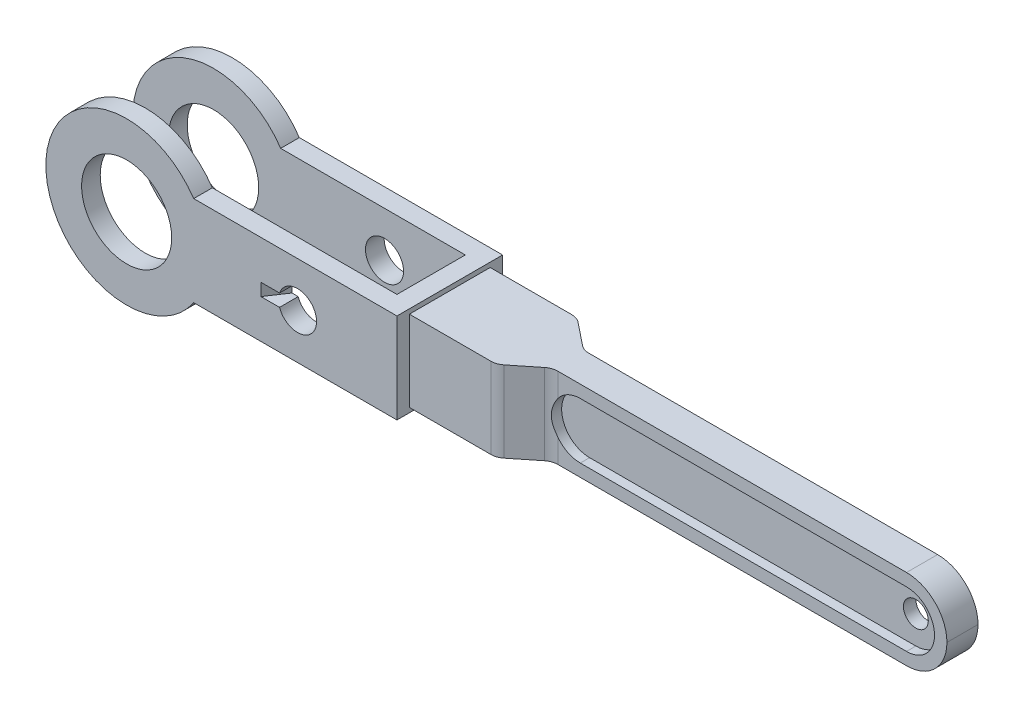
from build123d import *

# Parameters (mm, degrees)
ESBO_O1_R                  = 14.5
RESSALTO_EXTRUS_O1_DEPTH   = 34
CORTE_EXTRUS_O1_DEPTH      = 36
CORTE_EXTRUS_O1_DEPTH_BACK = 56
ESBO_O2_W                  = 115.279866195
ESBO_O2_H                  = 22
RESSALTO_EXTRUS_O2_DEPTH   = 4
RESSALTO_EXTRUS_O3_START   = -6
RESSALTO_EXTRUS_O3_DEPTH   = 6
ESBO_O5_W                  = 26
ESBO_O5_H                  = 26
RESSALTO_EXTRUS_O4_DEPTH   = 28
ESBO_O6_R                  = 9
CORTE_EXTRUS_O2_DEPTH      = 31
ESBO_O7_W                  = 10
ESBO_O7_H                  = 26
RESSALTO_EXTRUS_O5_DEPTH   = 10
RESSALTO_EXTRUS_O7_START   = -26
RESSALTO_EXTRUS_O7_DEPTH   = 26
FILETE1_R                  = 5
ESBO_O9_W                  = 10
ESBO_O9_H                  = 26
RESSALTO_EXTRUS_O8_DEPTH   = 127
FILETE2_R                  = 13
FILETE3_R                  = 5
CORTE_EXTRUS_O3_DEPTH      = 49
CORTE_EXTRUS_O3_DEPTH_BACK = 3
CORTE_EXTRUS_O4_DEPTH      = 52
CORTE_EXTRUS_O4_DEPTH_BACK = 3
CORTE_EXTRUS_O5_DEPTH      = 27
CORTE_EXTRUS_O5_DEPTH_BACK = 22
ESBO_O12_R                 = 4


with BuildPart() as part:
    # Esboço1 → Ressalto-extrusão1 (new body)
    with BuildSketch(Plane.XY):
        with BuildLine():
            Line((21.581241855, 14.5), (87, 14.5))
            Line((87, 14.5), (87, -14.5))
            Line((87, -14.5), (21.581241855, -14.5))
            ThreePointArc((21.581241855, -14.5), (-26, 0), (21.581241855, 14.5))
        make_face()
        Circle(ESBO_O1_R, mode=Mode.SUBTRACT)
        with BuildLine():
            ThreePointArc((49.210731912, -2), (61.125, 0), (49.210731912, 2))
            Line((49.210731912, 2), (43.210731912, 2))
            Line((43.210731912, 2), (43.210731912, -2))
            Line((43.210731912, -2), (49.210731912, -2))
        make_face(mode=Mode.SUBTRACT)
    extrude(amount=RESSALTO_EXTRUS_O1_DEPTH)

    # Esboço2 → Corte-extrusão1 (cut, two sides: drawn at the far end of the back side and taken through both)
    with BuildSketch(Plane(origin=(0, 14.5, 0), x_dir=(1, 0, 0), z_dir=(0, 1, 0)).offset(-CORTE_EXTRUS_O1_DEPTH_BACK)):
        with Locations((23.360066902, -17)):
            Rectangle(ESBO_O2_W, ESBO_O2_H)
    extrude(amount=CORTE_EXTRUS_O1_DEPTH + CORTE_EXTRUS_O1_DEPTH_BACK, mode=Mode.SUBTRACT)

    # Esboço3 → Ressalto-extrusão2 (add)
    with BuildSketch(Plane(origin=(0, -2, 0), x_dir=(1, 0, 0), z_dir=(0, 1, 0))):
        Polygon((43.210731912, -28), (47.210731912, -28), (43.210731912, -34), align=None)
    extrude(amount=RESSALTO_EXTRUS_O2_DEPTH)

    # Esboço4 → Ressalto-extrusão3 (add)
    with BuildSketch(Plane.XY.offset(6).offset(RESSALTO_EXTRUS_O3_START)):
        with BuildLine():
            ThreePointArc((49.210731912, 2), (48.875, 0), (49.210731912, -2))
            Line((49.210731912, -2), (43.210731912, -2))
            Line((43.210731912, -2), (43.210731912, 2))
            Line((43.210731912, 2), (49.210731912, 2))
        make_face()
    extrude(amount=RESSALTO_EXTRUS_O3_DEPTH)

    # Esboço5 → Ressalto-extrusão4 (add)
    with BuildSketch(Plane(origin=(87, 0, 0), x_dir=(0, 0, -1), z_dir=(1, 0, 0))):
        with Locations((-17, 0)):
            Rectangle(ESBO_O5_W, ESBO_O5_H)
    extrude(amount=RESSALTO_EXTRUS_O4_DEPTH)

    # Esboço6 → Corte-extrusão2 (cut)
    with BuildSketch(Plane.ZY.offset(-81)):
        with Locations((17, 0)):
            Circle(ESBO_O6_R)
    extrude(amount=-CORTE_EXTRUS_O2_DEPTH, mode=Mode.SUBTRACT)

    # Esboço7 → Ressalto-extrusão5 (add)
    with BuildSketch(Plane(origin=(115, 0, 0), x_dir=(0, 0, -1), z_dir=(1, 0, 0))):
        with Locations((-17, 0)):
            Rectangle(ESBO_O7_W, ESBO_O7_H)
    extrude(amount=RESSALTO_EXTRUS_O5_DEPTH)

    # Esboço8 → Ressalto-extrusão7 (add)
    with BuildSketch(Plane(origin=(0, 13, 0), x_dir=(1, 0, 0), z_dir=(0, 1, 0)).offset(RESSALTO_EXTRUS_O7_START)):
        Polygon((125, -12), (115, -4), (115, -12), align=None)
        Polygon((125, -22), (115, -22), (115, -30), align=None)
    extrude(amount=RESSALTO_EXTRUS_O7_DEPTH)

    # Filete1
    filete1_edges = [part.edges().sort_by_distance(p)[0] for p in [
        (115, 0, 30),
        (115, 0, 4),
    ]]
    fillet(filete1_edges, radius=FILETE1_R)

    # Esboço9 → Ressalto-extrusão8 (add)
    with BuildSketch(Plane(origin=(125, 0, 0), x_dir=(0, 0, -1), z_dir=(1, 0, 0))):
        with Locations((-17, 0)):
            Rectangle(ESBO_O9_W, ESBO_O9_H)
    extrude(amount=RESSALTO_EXTRUS_O8_DEPTH)

    # Filete2
    filete2_edges = [part.edges().sort_by_distance(p)[0] for p in [
        (252, -13, 17),
        (252, 13, 17),
    ]]
    fillet(filete2_edges, radius=FILETE2_R - 0.0001)  # a hair under: the kernel refuses the full size

    # Filete3
    filete3_edges = [part.edges().sort_by_distance(p)[0] for p in [
        (125, 0, 22),
        (125, 0, 12),
    ]]
    fillet(filete3_edges, radius=FILETE3_R)

    # Esboço10 → Corte-extrusão3 (cut, two sides: drawn at the far end of the back side and taken through both)
    with BuildSketch(Plane.XY.offset(22).offset(-CORTE_EXTRUS_O3_DEPTH_BACK)):
        with BuildLine():
            Line((134, 9), (239, 9))
            ThreePointArc((239, 9), (248, 0), (239, -9))
            Line((239, -9), (134, -9))
            ThreePointArc((134, -9), (125, 0), (134, 9))
        make_face()
    extrude(amount=CORTE_EXTRUS_O3_DEPTH + CORTE_EXTRUS_O3_DEPTH_BACK, mode=Mode.SUBTRACT)

    # Esboço11 → Corte-extrusão4 (cut, two sides: drawn at the far end of the back side and taken through both)
    with BuildSketch(Plane(origin=(0, 0, 12), x_dir=(-1, 0, 0), z_dir=(0, 0, -1)).offset(-CORTE_EXTRUS_O4_DEPTH_BACK)):
        with BuildLine():
            Line((-239, 9), (-134, 9))
            ThreePointArc((-134, 9), (-125, 0), (-134, -9))
            Line((-134, -9), (-239, -9))
            ThreePointArc((-239, -9), (-248, 0), (-239, 9))
        make_face()
    extrude(amount=CORTE_EXTRUS_O4_DEPTH + CORTE_EXTRUS_O4_DEPTH_BACK, mode=Mode.SUBTRACT)

    # Esboço12 → Corte-extrusão5 (cut, two sides: drawn at the far end of the back side and taken through both)
    with BuildSketch(Plane(origin=(0, 0, 15), x_dir=(-1, 0, 0), z_dir=(0, 0, -1)).offset(-CORTE_EXTRUS_O5_DEPTH_BACK)):
        with Locations(Location((-239, 0, 0), (0, 0, 180))):
            Circle(ESBO_O12_R)
    extrude(amount=CORTE_EXTRUS_O5_DEPTH + CORTE_EXTRUS_O5_DEPTH_BACK, mode=Mode.SUBTRACT)


solid = part.part
